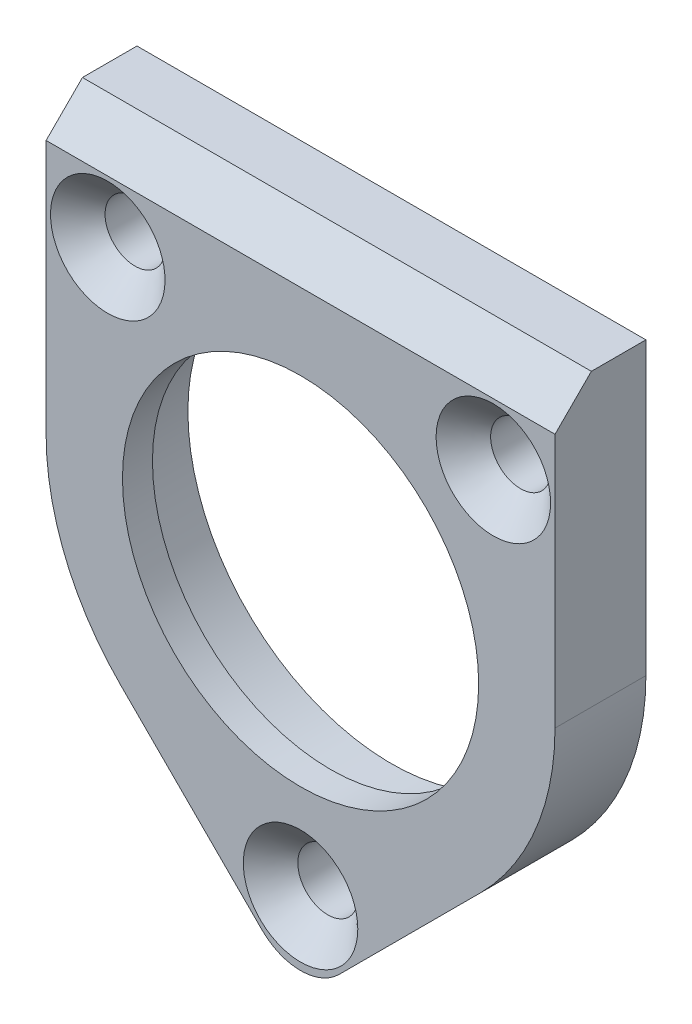
from build123d import *

# Parameters (mm, degrees)
EXTRUDE_3_DEPTH     = 5
SKETCH_1_R          = 9.79888
CUT_EXTRUDE_1_DEPTH = 1.65
SKETCH_1_9_R        = 3.15
SKETCH_3_8_R        = 1.65
SKETCH_3_9_R        = 1.648905
SKETCH_3_9_R_2      = 1.65
CUT_EXTRUDE_2_DEPTH = 5
EXTRUDE_4_DEPTH     = 28
SKETCH_10_R         = 11.19888
CUT_EXTRUDE_3_DEPTH = 3.35


with BuildPart() as part:
    # 草图7 → 凸台-拉伸3 (new body)
    with BuildSketch(Plane.XY):
        with BuildLine():
            Line((14, 14), (-14, 14))
            Line((-14, 14), (-14, 0))
            ThreePointArc((-14, 0), (-12.934313455, -5.357568053), (-9.899494937, -9.899494937))
            Line((-9.899494937, -9.899494937), (-2.121320344, -17.67766953))
            ThreePointArc((-2.121320344, -17.67766953), (0.000404905, -18.556181469), (2.121892965, -17.677096908))
            Line((2.121892965, -17.677096908), (9.899494937, -9.899494937))
            ThreePointArc((9.899494937, -9.899494937), (12.934313455, -5.357568053), (14, 0))
            Line((14, 0), (14, 14))
        make_face()
    extrude(amount=-EXTRUDE_3_DEPTH)

    # 草图1 → 切除-拉伸1 (cut)
    with BuildSketch(Plane.XY):
        Circle(SKETCH_1_R)
    extrude(amount=-CUT_EXTRUDE_1_DEPTH, mode=Mode.SUBTRACT)

    # 切除-放样1: read off the stored shape, not the designer's step
    # 切除-放样1 outline → 切除-放样1 (revolve, cut)
    with BuildSketch(Plane(origin=(10.6066, 10.606603436, 0), x_dir=(1, 0, 0), z_dir=(0, -1, 0))):
        Polygon((0, 0), (0, -1.5), (1.648905, -1.5), (3.15, 0), align=None)
    revolve(axis=Axis((10.6066, 10.606603436, 0), (0, 0, 1)), mode=Mode.SUBTRACT)

    # 切除-放样2: read off the stored shape, not the designer's step
    # 切除-放样2: loft between two sections, ruled curve by curve
    loft_2_from = [
        Edge.make_bspline([(-8.058196468, 12.45812698, 0), (-4.355149378, 7.361319916, 0), (-9.451956443, 3.658272826, 0), (-13.155003532, 8.755079891, 0), (-16.858050622, 13.851886955, 0), (-11.761243557, 17.554934045, 0), (-8.058196468, 12.45812698, 0)], [0, 0, 0, 0, 0.5, 0.5, 0.5, 1, 1, 1, 1], 3, [1, 0.333333333, 0.333333333, 1, 0.333333333, 0.333333333, 1]),
    ]
    loft_2_to = [
        Edge.make_bspline([(-9.518492924, 11.845518562, -1.5), (-7.040662671, 9.669304411, -1.5), (-9.216876823, 7.191474158, -1.5), (-11.694707076, 9.367688309, -1.5), (-14.172537329, 11.543902461, -1.5), (-11.996323177, 14.021732714, -1.5), (-9.518492924, 11.845518562, -1.5)], [0, 0, 0, 0, 0.5, 0.5, 0.5, 1, 1, 1, 1], 3, [1, 0.333333333, 0.333333333, 1, 0.333333333, 0.333333333, 1]),
    ]
    loft_2 = Solid(Shell([*[Face.make_surface_from_curves(loft_2_from[k], loft_2_to[k]) for k in range(1)], Face(Wire(loft_2_from)), Face(Wire(loft_2_to))]))
    add(loft_2, mode=Mode.SUBTRACT)

    # 草图1<9> → 切除-放样3 section 0
    with BuildSketch(Plane.XY):
        with Locations((0, -14.999996564)):
            Circle(SKETCH_1_9_R)
    # 草图3<8> → 切除-放样3 section 1
    with BuildSketch(Plane.XY.offset(-1.5)):
        with Locations((0, -14.999996564)):
            Circle(SKETCH_3_8_R)
    loft(mode=Mode.SUBTRACT)

    # 草图3<9> → 切除-拉伸2 (cut)
    with BuildSketch(Plane.XY.offset(-1.5)):
        with Locations(Location((-10.6066, 10.606603436, 0), (0, 0, 48.708))):
            Circle(SKETCH_3_9_R)
        with Locations((10.6066, 10.606603436)):
            Circle(SKETCH_3_9_R)
        with Locations((0, -14.999996564)):
            Circle(SKETCH_3_9_R_2)
    extrude(amount=-CUT_EXTRUDE_2_DEPTH, mode=Mode.SUBTRACT)

    # 草图9 → 凸台-拉伸4 (add)
    with BuildSketch(Plane(origin=(14, 0, 0), x_dir=(0, 0, -1), z_dir=(1, 0, 0))):
        Polygon((5, 14), (5, 16), (2, 16), (0, 14), align=None)
    extrude(amount=-EXTRUDE_4_DEPTH)

    # 草图10 → 切除-拉伸3 (cut)
    with BuildSketch(Plane(origin=(0, 0, -5), x_dir=(-1, 0, 0), z_dir=(0, 0, -1))):
        Circle(SKETCH_10_R)
    extrude(amount=-CUT_EXTRUDE_3_DEPTH, mode=Mode.SUBTRACT)


solid = part.part
